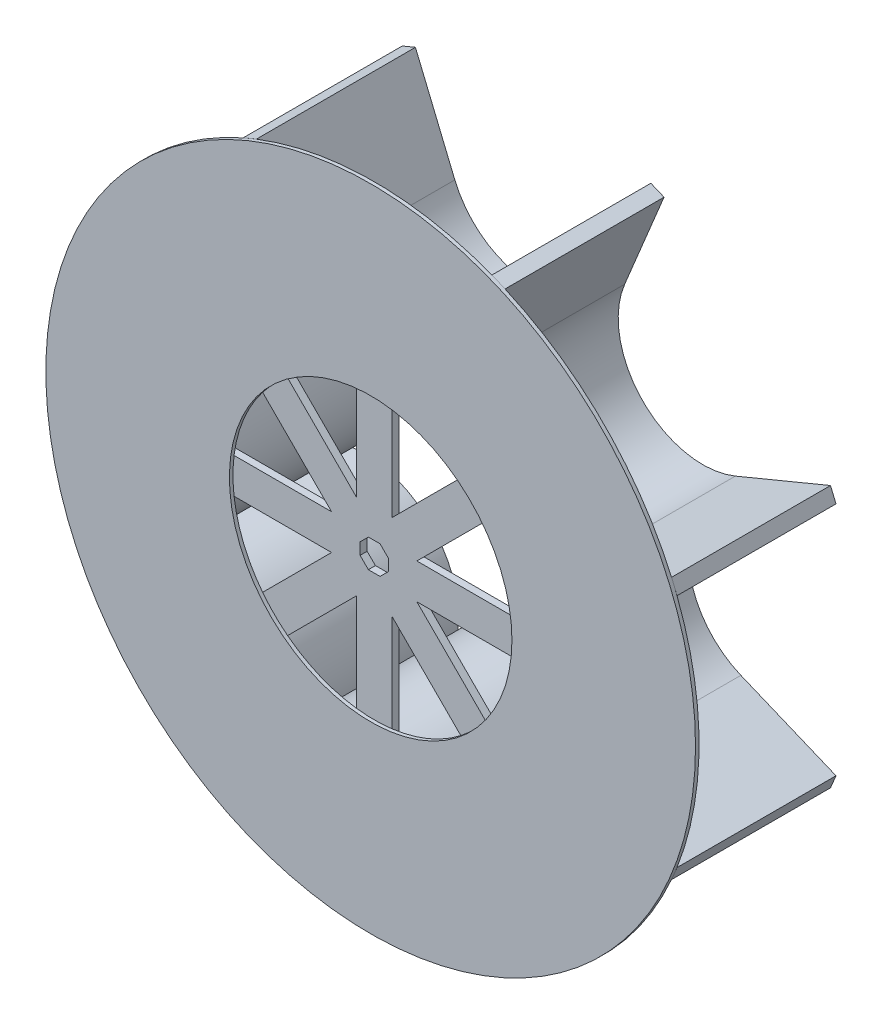
from build123d import *

# Parameters (mm, degrees)
MAIN_EXTRUSION_DEPTH         = 45
R_P_TITION_CIRCULAIRE1_DEPTH = 45
ESQUISSE2_R                  = 91.977766886
ESQUISSE2_R_2                = 40
GLOBAL_CIRCLE_DEPTH          = 1
CENTRAL_START                = 2
CENTRAL_FIXING_DEPTH         = 2
R_P_TITION_CIRCULAIRE2_COUNT = 8


# Read off the part's stored shape, not the designer's step: Répétition circulaire1
with BuildPart() as part:
    # Esquisse1 → Main Extrusion (new body)
    with BuildSketch(Plane.XY):
        with BuildLine():
            Line((57.667547326, 24.944747378), (84.602293038, 36.101484351))
            Line((84.602293038, 36.101484351), (85.750343335, 33.329845753))
            Line((85.750343335, 33.329845753), (58.815597623, 22.17310878))
            ThreePointArc((58.815597623, 22.17310878), (44, 0), (58.815597623, -22.17310878))
            Line((58.815597623, -22.17310878), (85.750343335, -33.329845753))
            Line((85.750343335, -33.329845753), (84.602293038, -36.101484351))
            Line((84.602293038, -36.101484351), (57.667547326, -24.944747378))
            ThreePointArc((57.667547326, -24.944747378), (41, 0), (57.667547326, 24.944747378))
        make_face()
    extrude(amount=MAIN_EXTRUSION_DEPTH)

    # Répétition circulaire1 outline → Répétition circulaire1 (add)
    with BuildSketch(Plane.XY):
        with BuildLine():
            Line((-84.202409209, -37.066889313), (-57.267663497, -25.91015234))
            ThreePointArc((-57.267663497, -25.91015234), (-31.112698372, -31.112698372), (-25.91015234, -57.267663497))
            Line((-25.91015234, -57.267663497), (-37.066889313, -84.202409209))
            Line((-37.066889313, -84.202409209), (-33.329845753, -85.750343335))
            Line((-33.329845753, -85.750343335), (-22.17310878, -58.815597623))
            ThreePointArc((-22.17310878, -58.815597623), (0, -44), (22.17310878, -58.815597623))
            Line((22.17310878, -58.815597623), (33.329845753, -85.750343335))
            Line((33.329845753, -85.750343335), (37.066889313, -84.202409209))
            Line((37.066889313, -84.202409209), (25.91015234, -57.267663497))
            ThreePointArc((25.91015234, -57.267663497), (31.112698372, -31.112698372), (57.267663497, -25.91015234))
            Line((57.267663497, -25.91015234), (84.202409209, -37.066889313))
            Line((84.202409209, -37.066889313), (84.602293038, -36.101484351))
            Line((84.602293038, -36.101484351), (57.667547326, -24.944747378))
            ThreePointArc((57.667547326, -24.944747378), (54.405305377, -23.327757675), (51.390283197, -21.286552275))
            ThreePointArc((51.390283197, -21.286552275), (28.991378029, -28.991378029), (21.286552275, -51.390283197))
            ThreePointArc((21.286552275, -51.390283197), (0, -41), (-21.286552275, -51.390283197))
            ThreePointArc((-21.286552275, -51.390283197), (-28.991378029, -28.991378029), (-51.390283197, -21.286552275))
            ThreePointArc((-51.390283197, -21.286552275), (-41, 0), (-51.390283197, 21.286552275))
            ThreePointArc((-51.390283197, 21.286552275), (-28.991378029, 28.991378029), (-21.286552275, 51.390283197))
            ThreePointArc((-21.286552275, 51.390283197), (0, 41), (21.286552275, 51.390283197))
            ThreePointArc((21.286552275, 51.390283197), (28.991378029, 28.991378029), (51.390283197, 21.286552275))
            ThreePointArc((51.390283197, 21.286552275), (54.405305377, 23.327757675), (57.667547326, 24.944747378))
            Line((57.667547326, 24.944747378), (84.602293038, 36.101484351))
            Line((84.602293038, 36.101484351), (84.202409209, 37.066889313))
            Line((84.202409209, 37.066889313), (57.267663497, 25.91015234))
            ThreePointArc((57.267663497, 25.91015234), (31.112698372, 31.112698372), (25.91015234, 57.267663497))
            Line((25.91015234, 57.267663497), (37.066889313, 84.202409209))
            Line((37.066889313, 84.202409209), (33.329845753, 85.750343335))
            Line((33.329845753, 85.750343335), (22.17310878, 58.815597623))
            ThreePointArc((22.17310878, 58.815597623), (0, 44), (-22.17310878, 58.815597623))
            Line((-22.17310878, 58.815597623), (-33.329845753, 85.750343335))
            Line((-33.329845753, 85.750343335), (-37.066889313, 84.202409209))
            Line((-37.066889313, 84.202409209), (-25.91015234, 57.267663497))
            ThreePointArc((-25.91015234, 57.267663497), (-31.112698372, 31.112698372), (-57.267663497, 25.91015234))
            Line((-57.267663497, 25.91015234), (-84.202409209, 37.066889313))
            Line((-84.202409209, 37.066889313), (-85.750343335, 33.329845753))
            Line((-85.750343335, 33.329845753), (-58.815597623, 22.17310878))
            ThreePointArc((-58.815597623, 22.17310878), (-44, 0), (-58.815597623, -22.17310878))
            Line((-58.815597623, -22.17310878), (-85.750343335, -33.329845753))
            Line((-85.750343335, -33.329845753), (-84.202409209, -37.066889313))
        make_face()
    extrude(amount=R_P_TITION_CIRCULAIRE1_DEPTH)

    # Esquisse2 → Global Circle (add)
    with BuildSketch(Plane.XY.offset(45)):
        with Locations(Location((0, 0, 0), (0, 0, 201.240037576))):
            Circle(ESQUISSE2_R)
        Circle(ESQUISSE2_R_2, mode=Mode.SUBTRACT)
    extrude(amount=GLOBAL_CIRCLE_DEPTH)

    # Esquisse3 → Central Fixing (add)
    with BuildSketch(Plane(origin=(0, 0, 45), x_dir=(-1, 0, 0), z_dir=(0, 0, -1)).offset(CENTRAL_START)):
        with BuildLine():
            Line((-5, 44.526610811), (-5, 0))
            Line((-5, 0), (-4, 0))
            Line((-4, 0), (-4, 5))
            Line((-4, 5), (4, 5))
            Line((4, 5), (4, 0))
            Line((4, 0), (5, 0))
            Line((5, 0), (5, 44.526610811))
            ThreePointArc((5, 44.526610811), (0, 44), (-5, 44.526610811))
        make_face()
    central_fixing = extrude(amount=-CENTRAL_FIXING_DEPTH)

    # Répétition circulaire2: Central Fixing ×8 about axis
    r_p_tition_circulaire2_axis = Axis((0, 0, 0), (0, 0, 1))
    for i in range(1, R_P_TITION_CIRCULAIRE2_COUNT):
        add(central_fixing.rotate(r_p_tition_circulaire2_axis, i * 360 / R_P_TITION_CIRCULAIRE2_COUNT))


solid = part.part
